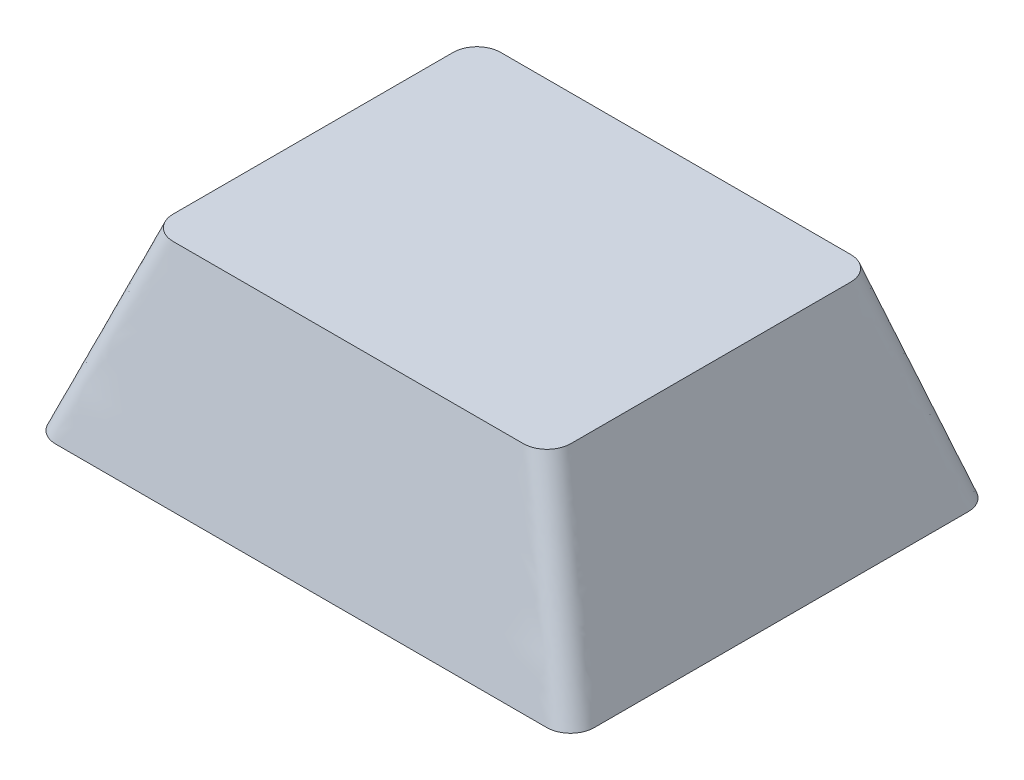
from build123d import *


with BuildPart() as part:
    # Croquis3 for Recubrir1 → Recubrir1 section 0
    with BuildSketch(Plane(origin=(0, 8.001, 0), x_dir=(1, 0, 0), z_dir=(0, 1, 0))):
        with BuildLine():
            Line((-7.4803, -6.9977), (7.4803, -6.9977))
            # circular arc as an exact rational Bezier (weights 1, cos(half-angle), 1)
            Bezier((7.4803, -6.9977), (8.4963, -6.9977), (8.4963, -5.9817), weights=[1, 0.707106781, 1])
            Line((8.4963, -5.9817), (8.4963, 5.9817))
            Bezier((8.4963, 5.9817), (8.4963, 6.9977), (7.4803, 6.9977), weights=[1, 0.707106781, 1])
            Line((7.4803, 6.9977), (-7.4803, 6.9977))
            Bezier((-7.4803, 6.9977), (-8.4963, 6.9977), (-8.4963, 5.9817), weights=[1, 0.707106781, 1])
            Line((-8.4963, 5.9817), (-8.4963, -5.9817))
            Bezier((-8.4963, -5.9817), (-8.4963, -6.9977), (-7.4803, -6.9977), weights=[1, 0.707106781, 1])
        make_face()
    # Croquis2 for Recubrir1 → Recubrir1 section 1
    with BuildSketch(Plane(origin=(0, 0, 0), x_dir=(1, 0, 0), z_dir=(0, 1, 0))):
        with BuildLine():
            Line((-10.4902, -9.0043), (10.4902, -9.0043))
            Bezier((10.4902, -9.0043), (11.5062, -9.0043), (11.5062, -7.9883), weights=[1, 0.707106781, 1])
            Line((11.5062, -7.9883), (11.5062, 7.9883))
            Bezier((11.5062, 7.9883), (11.5062, 9.0043), (10.4902, 9.0043), weights=[1, 0.707106781, 1])
            Line((10.4902, 9.0043), (-10.4902, 9.0043))
            Bezier((-10.4902, 9.0043), (-11.5062, 9.0043), (-11.5062, 7.9883), weights=[1, 0.707106781, 1])
            Line((-11.5062, 7.9883), (-11.5062, -7.9883))
            Bezier((-11.5062, -7.9883), (-11.5062, -9.0043), (-10.4902, -9.0043), weights=[1, 0.707106781, 1])
        make_face()
    loft()


solid = part.part
